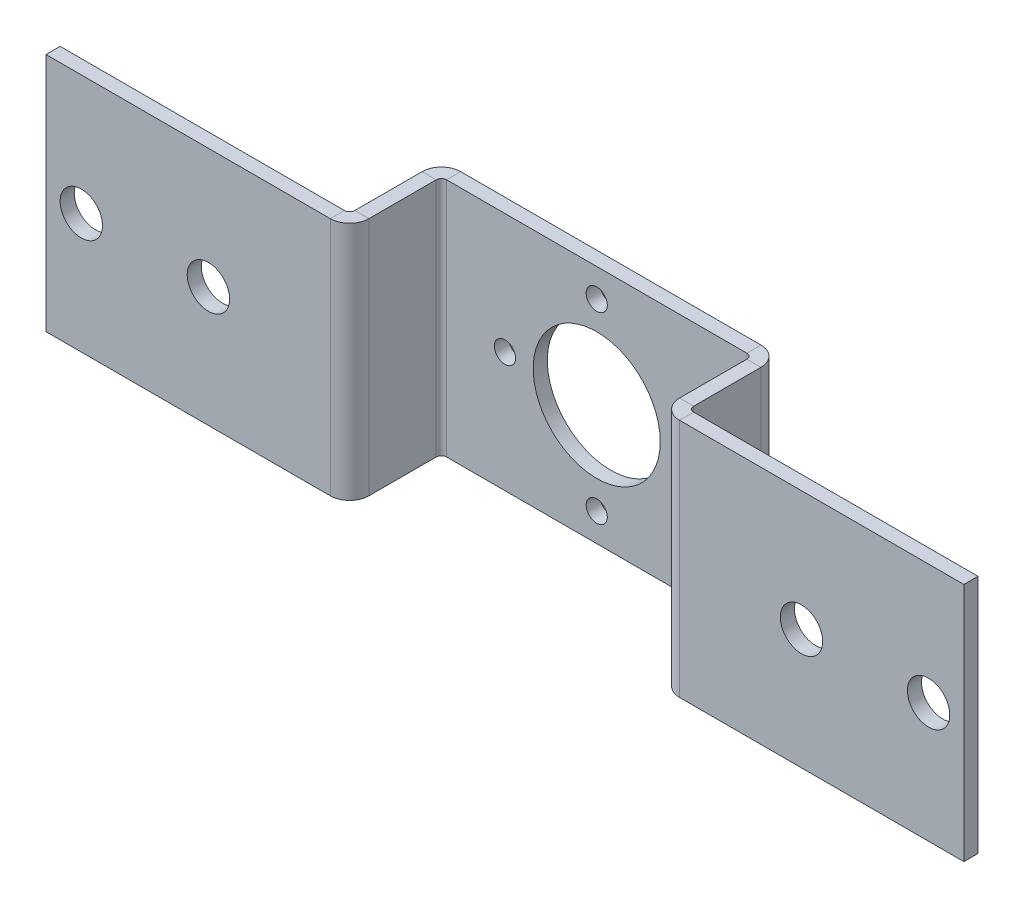
from build123d import *

# Parameters (mm, degrees)
SKETCH1_W                      = 44
SKETCH1_H                      = 34
SKETCH1_R                      = 9
SKETCH1_R_2                    = 1.5
BASE_FLANGE1_DEPTH             = 2
EDGE_FLANGE1_STRIP_W           = 9.4732
EDGE_FLANGE1_STRIP_H           = 2
EDGE_FLANGE1_STRIP_CUT_DEPTH   = 34
EDGE_FLANGE1_STRIP_2_W         = 9.4732
EDGE_FLANGE1_STRIP_2_H         = 2
EDGE_FLANGE1_STRIP_CUT_2_DEPTH = 34
EDGE_FLANGE1_DEPTH             = 34
EDGE_FLANGE1_BEND_DEPTH        = 34
EDGE_FLANGE2_STRIP_W           = 9.4732
EDGE_FLANGE2_STRIP_H           = 2
EDGE_FLANGE2_STRIP_CUT_DEPTH   = 34
EDGE_FLANGE2_STRIP_2_W         = 9.4732
EDGE_FLANGE2_STRIP_2_H         = 2
EDGE_FLANGE2_STRIP_CUT_2_DEPTH = 34
EDGE_FLANGE2_DEPTH             = 34
EDGE_FLANGE2_BEND_DEPTH        = 34
SKETCH18_R                     = 3
CUT_EXTRUDE1_DEPTH             = 10


# Sheet-metal steps are written as plain solids
with BuildPart() as part:
    # Sketch1 → Base-Flange1 (new body)
    with BuildSketch(Plane.XY):
        Rectangle(SKETCH1_W, SKETCH1_H)
        Circle(SKETCH1_R, mode=Mode.SUBTRACT)
        with Locations((0, 13)):
            Circle(SKETCH1_R_2, mode=Mode.SUBTRACT)
        with Locations((13, 0)):
            Circle(SKETCH1_R_2, mode=Mode.SUBTRACT)
        with Locations((0, -13)):
            Circle(SKETCH1_R_2, mode=Mode.SUBTRACT)
        with Locations((-13, 0)):
            Circle(SKETCH1_R_2, mode=Mode.SUBTRACT)
    extrude(amount=-BASE_FLANGE1_DEPTH)

    # Edge-Flange1 strip (across the edge) → Edge-Flange1 strip cut (cut)
    with BuildSketch(Plane(origin=(-22, 17, 0), x_dir=(1, 0, 0), z_dir=(0, -1, 0))):
        with Locations((-4, -1)):
            Rectangle(EDGE_FLANGE1_STRIP_W, EDGE_FLANGE1_STRIP_H)
    extrude(amount=EDGE_FLANGE1_STRIP_CUT_DEPTH, mode=Mode.SUBTRACT)

    # Edge-Flange1 strip 2 (across the edge) → Edge-Flange1 strip cut 2 (cut)
    with BuildSketch(Plane(origin=(22, -17, 0), x_dir=(-1, 0, 0), z_dir=(0, 1, 0))):
        with Locations((-4, -1)):
            Rectangle(EDGE_FLANGE1_STRIP_2_W, EDGE_FLANGE1_STRIP_2_H)
    extrude(amount=EDGE_FLANGE1_STRIP_CUT_2_DEPTH, mode=Mode.SUBTRACT)

    # Edge-Flange1 section (across the edge) → Edge-Flange1 (add)
    with BuildSketch(Plane(origin=(-22, 17, 0), x_dir=(1, 0, 0), z_dir=(0, -1, 0))):
        with BuildLine():
            Line((-2, 0.7366), (-2, 11))
            Line((-2, 11), (0, 11))
            Line((0, 11), (0, 0.7366))
            ThreePointArc((0, 0.7366), (0.215745145, 0.215745145), (0.7366, 0))
            Line((0.7366, 0), (0.7366, -2))
            ThreePointArc((0.7366, -2), (-1.198468417, -1.198468417), (-2, 0.7366))
        make_face()
    extrude(amount=EDGE_FLANGE1_DEPTH)

    # Edge-Flange1 section 2 (across the edge) → Edge-Flange1 bend (add)
    with BuildSketch(Plane(origin=(22, -17, 0), x_dir=(-1, 0, 0), z_dir=(0, 1, 0))):
        with BuildLine():
            Line((-2, 0.7366), (-2, 11))
            Line((-2, 11), (0, 11))
            Line((0, 11), (0, 0.7366))
            ThreePointArc((0, 0.7366), (0.215745145, 0.215745145), (0.7366, 0))
            Line((0.7366, 0), (0.7366, -2))
            ThreePointArc((0.7366, -2), (-1.198468417, -1.198468417), (-2, 0.7366))
        make_face()
    extrude(amount=EDGE_FLANGE1_BEND_DEPTH)

    # Edge-Flange2 strip (across the edge) → Edge-Flange2 strip cut (cut)
    with BuildSketch(Plane(origin=(-24, -17, 11), x_dir=(0, 0, -1), z_dir=(0, 1, 0))):
        with Locations((-4, -1)):
            Rectangle(EDGE_FLANGE2_STRIP_W, EDGE_FLANGE2_STRIP_H)
    extrude(amount=EDGE_FLANGE2_STRIP_CUT_DEPTH, mode=Mode.SUBTRACT)

    # Edge-Flange2 strip 2 (across the edge) → Edge-Flange2 strip cut 2 (cut)
    with BuildSketch(Plane(origin=(24, 17, 11), x_dir=(0, 0, -1), z_dir=(0, -1, 0))):
        with Locations((-4, -1)):
            Rectangle(EDGE_FLANGE2_STRIP_2_W, EDGE_FLANGE2_STRIP_2_H)
    extrude(amount=EDGE_FLANGE2_STRIP_CUT_2_DEPTH, mode=Mode.SUBTRACT)

    # Edge-Flange2 section (across the edge) → Edge-Flange2 (add)
    with BuildSketch(Plane(origin=(-24, -17, 11), x_dir=(0, 0, -1), z_dir=(0, 1, 0))):
        with BuildLine():
            Line((-2, 0.7366), (-2, 41))
            Line((-2, 41), (0, 41))
            Line((0, 41), (0, 0.7366))
            ThreePointArc((0, 0.7366), (0.215745145, 0.215745145), (0.7366, 0))
            Line((0.7366, 0), (0.7366, -2))
            ThreePointArc((0.7366, -2), (-1.198468417, -1.198468417), (-2, 0.7366))
        make_face()
    extrude(amount=EDGE_FLANGE2_DEPTH)

    # Edge-Flange2 section 2 (across the edge) → Edge-Flange2 bend (add)
    with BuildSketch(Plane(origin=(24, 17, 11), x_dir=(0, 0, -1), z_dir=(0, -1, 0))):
        with BuildLine():
            Line((-2, 0.7366), (-2, 41))
            Line((-2, 41), (0, 41))
            Line((0, 41), (0, 0.7366))
            ThreePointArc((0, 0.7366), (0.215745145, 0.215745145), (0.7366, 0))
            Line((0.7366, 0), (0.7366, -2))
            ThreePointArc((0.7366, -2), (-1.198468417, -1.198468417), (-2, 0.7366))
        make_face()
    extrude(amount=EDGE_FLANGE2_BEND_DEPTH)

    # Sketch18 → Cut-Extrude1 (cut)
    with BuildSketch(Plane(origin=(0, 0, 11), x_dir=(-1, 0, 0), z_dir=(0, 0, -1))):
        with Locations((60, 0)):
            Circle(SKETCH18_R)
        with Locations((42, 0)):
            Circle(SKETCH18_R)
        with Locations((-60, 0)):
            Circle(SKETCH18_R)
        with Locations((-42, 0)):
            Circle(SKETCH18_R)
    extrude(amount=-CUT_EXTRUDE1_DEPTH, mode=Mode.SUBTRACT)


solid = part.part
